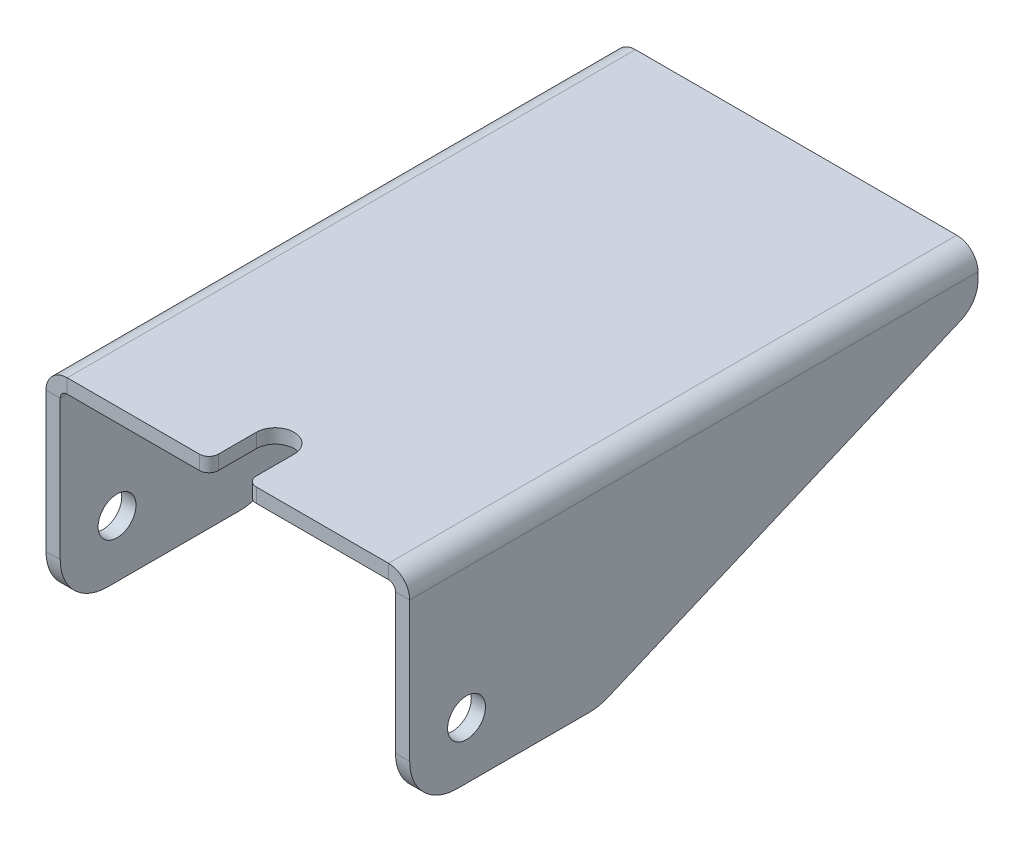
from build123d import *

# Parameters (mm, degrees)
SKETCH1_W                    = 17.7
SKETCH1_H                    = 60
BASE_FLANGE2_DEPTH           = 1.5
EDGE_FLANGE2_STRIP_W         = 7.4732
EDGE_FLANGE2_STRIP_H         = 1.5
EDGE_FLANGE2_STRIP_CUT_DEPTH = 60
EDGE_FLANGE2_DEPTH           = 60
CUT_EXTRUDE5_DEPTH           = 1.5
FILLET4_R                    = 5
FILLET5_R                    = 3
SKETCH22_R                   = 2
CUT_EXTRUDE6_DEPTH           = 1.5
CUT_EXTRUDE7_REACH           = 68.728
FILLET6_R                    = 1


# Sheet-metal steps are written as plain solids
with BuildPart() as part:
    # Sketch1 → Base-Flange2 (new body)
    with BuildSketch(Plane(origin=(0, 0, 0), x_dir=(1, 0, 0), z_dir=(0, 1, 0))):
        with Locations((-8.85, -30)):
            Rectangle(SKETCH1_W, SKETCH1_H)
    extrude(amount=-BASE_FLANGE2_DEPTH)

    # Edge-Flange2 strip (across the edge) → Edge-Flange2 strip cut (cut)
    with BuildSketch(Plane(origin=(-17.7, -1.5, 60), x_dir=(1, 0, 0), z_dir=(0, 0, -1))):
        with Locations((-3, -0.75)):
            Rectangle(EDGE_FLANGE2_STRIP_W, EDGE_FLANGE2_STRIP_H)
    extrude(amount=EDGE_FLANGE2_STRIP_CUT_DEPTH, mode=Mode.SUBTRACT)

    # Edge-Flange2 section (across the edge) → Edge-Flange2 (add)
    with BuildSketch(Plane(origin=(-17.7, -1.5, 60), x_dir=(1, 0, 0), z_dir=(0, 0, -1))):
        with BuildLine():
            Line((-1.5, 0.7366), (-1.5, 20.5))
            Line((-1.5, 20.5), (0, 20.5))
            Line((0, 20.5), (0, 0.7366))
            ThreePointArc((0, 0.7366), (0.215745145, 0.215745145), (0.7366, 0))
            Line((0.7366, 0), (0.7366, -1.5))
            ThreePointArc((0.7366, -1.5), (-0.844915027, -0.844915027), (-1.5, 0.7366))
        make_face()
    extrude(amount=EDGE_FLANGE2_DEPTH)

    # Sketch20 → Cut-Extrude5 (cut)
    with BuildSketch(Plane.ZY.offset(19.2)):
        Polygon((0, -5), (40, -22), (0, -22), align=None)
    extrude(amount=-CUT_EXTRUDE5_DEPTH, mode=Mode.SUBTRACT)

    # Fillet4
    fillet4_edges = [part.edges().sort_by_distance(p)[0] for p in [
        (-18.45, -22, 60),
        (-18.45, -22, 40),
    ]]
    fillet(fillet4_edges, radius=FILLET4_R)

    # Fillet5
    fillet5_edges = [part.edges().sort_by_distance(p)[0] for p in [
        (-18.45, -5, 0),
    ]]
    fillet(fillet5_edges, radius=FILLET5_R)

    # Sketch22 → Cut-Extrude6 (cut)
    with BuildSketch(Plane.ZY.offset(19.2)):
        with Locations(Location((54, -16, 0), (0, 0, 270))):
            Circle(SKETCH22_R)
    extrude(amount=-CUT_EXTRUDE6_DEPTH, mode=Mode.SUBTRACT)

    # Mirror1: part across plane


with BuildPart() as part_1:
    add(part.part)
    add(part.part.mirror(Plane(origin=(0, -1.5, 60), x_dir=(0, 0, 1), z_dir=(1, 0, 0))))

    # Sketch28 → Cut-Extrude7 (cut, up to next)
    with BuildSketch(Plane(origin=(0, 0, 0), x_dir=(1, 0, 0), z_dir=(0, 1, 0)), mode=Mode.PRIVATE) as cut_extrude7_sk1:
        with BuildLine():
            Line((2, -55), (2, -60))
            Line((2, -60), (-2, -60))
            Line((-2, -60), (-2, -55))
            ThreePointArc((-2, -55), (0, -53), (2, -55))
        make_face()
    cut_extrude7_tool1 = extrude(cut_extrude7_sk1.sketch, amount=-CUT_EXTRUDE7_REACH, mode=Mode.PRIVATE) & part_1.part
    add(cut_extrude7_tool1.solids().sort_by_distance((0, 0, 56.699439))[0], mode=Mode.SUBTRACT)

    # Fillet6
    fillet6_edges = [part_1.edges().sort_by_distance(p)[0] for p in [
        (2, -0.75, 60),
        (-2, -0.75, 60),
    ]]
    fillet(fillet6_edges, radius=FILLET6_R)


solid = part_1.part
